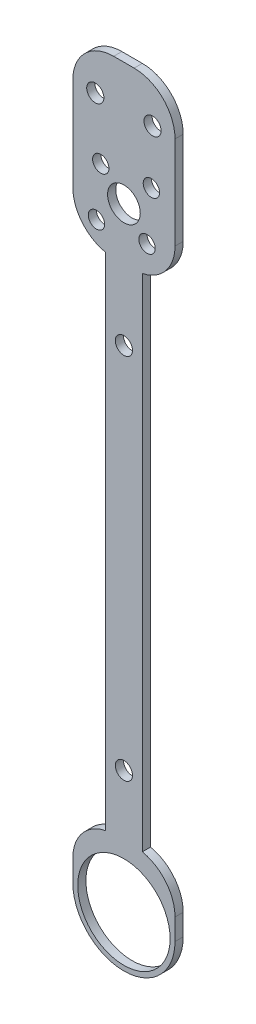
from build123d import *

# Parameters (mm, degrees)
SKETCH1_R           = 11.3
SKETCH1_R_2         = 4
SKETCH1_R_3         = 2
BOSS_EXTRUDE1_DEPTH = 2
FILLET1_R           = 10
SKETCH2_R           = 2.1
CUT_EXTRUDE1_DEPTH  = 182.73882359


with BuildPart() as part:
    # Sketch1 → Boss-Extrude1 (new body)
    with BuildSketch(Plane.XY):
        with BuildLine():
            ThreePointArc((0, 0), (12.5, -12.5), (25, 0))
            Line((25, 0), (25, 15))
            Line((25, 15), (17, 15))
            Line((17, 15), (17, 137.5))
            Line((17, 137.5), (25, 137.5))
            Line((25, 137.5), (25, 180))
            Line((25, 180), (0, 180))
            Line((0, 180), (0, 137.5))
            Line((0, 137.5), (8, 137.5))
            Line((8, 137.5), (8, 15))
            Line((8, 15), (0, 15))
            Line((0, 15), (0, 0))
        make_face()
        with Locations((12.5, 0)):
            Circle(SKETCH1_R, mode=Mode.SUBTRACT)
        with Locations((12.5, 150)):
            Circle(SKETCH1_R_2, mode=Mode.SUBTRACT)
        with Locations((18.156854249, 144.343145751)):
            Circle(SKETCH1_R_3, mode=Mode.SUBTRACT)
        with Locations((5.782485579, 143.282485579)):
            Circle(SKETCH1_R_3, mode=Mode.SUBTRACT)
        with Locations((19.217514421, 156.717514421)):
            Circle(SKETCH1_R_3, mode=Mode.SUBTRACT)
        with Locations((6.843145751, 155.656854249)):
            Circle(SKETCH1_R_3, mode=Mode.SUBTRACT)
    extrude(amount=BOSS_EXTRUDE1_DEPTH)

    # Fillet1
    # the kernel refuses this fillet: 10 mm, written as the material it takes off along each edge
    with BuildSketch(Plane(origin=(25, 15, -24.494897428), x_dir=(0, -1, 0), z_dir=(0, 0, 1)), Plane(origin=(0, 137.5, -24.494897428), x_dir=(0, 1, 0), z_dir=(0, 0, 1))) as fillet1_piece_1:
        with BuildLine():
            CenterArc((9.797958971, -10), FILLET1_R, 90, 78.463040967)
            Line((0, -8), (-0.195959179, -7.96))
            ThreePointArc((-0.195959179, -7.96), (-0.2, -4), (-0.2, 0))
            Line((-0.2, 0), (0, 0.2))
            Line((0, 0.2), (9.797958971, 0.2))
            Line((9.797958971, 0.2), (9.797958971, 0))
        make_face()
    extrude(amount=50.989794856, mode=Mode.SUBTRACT)
    with BuildSketch(Plane(origin=(0, 15, -24.494897428), x_dir=(1, 0, 0), z_dir=(0, 0, 1)), Plane(origin=(25, 137.5, -24.494897428), x_dir=(-1, 0, 0), z_dir=(0, 0, 1))) as fillet1_piece_2:
        with BuildLine():
            CenterArc((10, -9.797958971), FILLET1_R, 101.536959033, 78.463040967)
            Line((0, -9.797958971), (-0.2, -9.797958971))
            Line((-0.2, -9.797958971), (-0.2, 0))
            Line((-0.2, 0), (0, 0.2))
            ThreePointArc((0, 0.2), (4, 0.2), (7.96, 0.195959179))
            Line((7.96, 0.195959179), (8, 0))
        make_face()
    extrude(amount=50.989794856, mode=Mode.SUBTRACT)
    with BuildSketch(Plane(origin=(0, 180, -25), x_dir=(1, 0, 0), z_dir=(0, 0, 1)), Plane(origin=(25, 180, -25), x_dir=(0, -1, 0), z_dir=(0, 0, 1))) as fillet1_piece_3:
        with BuildLine():
            CenterArc((FILLET1_R, -FILLET1_R), FILLET1_R, 90, 90)
            Line((0, -FILLET1_R), (-FILLET1_R * 0.02, -FILLET1_R))
            Line((-FILLET1_R * 0.02, -FILLET1_R), (-FILLET1_R * 0.02, FILLET1_R * 0.02))
            Line((-FILLET1_R * 0.02, FILLET1_R * 0.02), (FILLET1_R, FILLET1_R * 0.02))
            Line((FILLET1_R, FILLET1_R * 0.02), (FILLET1_R, 0))
        make_face()
    extrude(amount=52, mode=Mode.SUBTRACT)

    # Sketch2 → Cut-Extrude1 (cut, through all)
    with BuildSketch(Plane(origin=(0, 0, 0), x_dir=(-1, 0, 0), z_dir=(0, 0, -1))):
        with Locations((-12.5, 120)):
            Circle(SKETCH2_R)
        with Locations((-12.5, 30)):
            Circle(SKETCH2_R)
        with Locations((-19.5, 170)):
            Circle(SKETCH2_R)
        with Locations(Location((-5.5, 170, 0), (0, 0, 180))):
            Circle(SKETCH2_R)
    extrude(amount=-CUT_EXTRUDE1_DEPTH, mode=Mode.SUBTRACT)


solid = part.part
